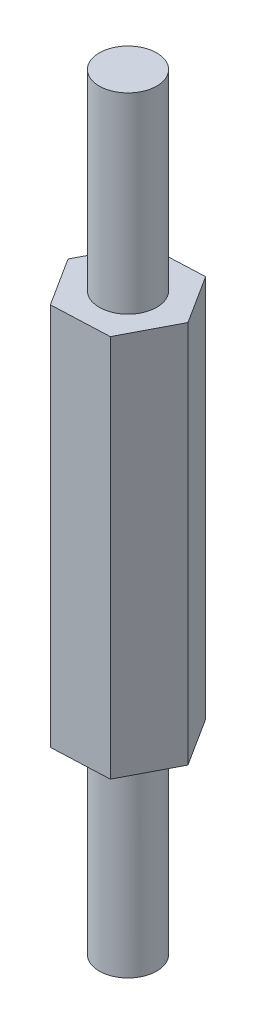
from build123d import *

# Parameters (mm, degrees)
BOSS_EXTRUDE1_DEPTH = 20
SKETCH4_R           = 1.5
BOSS_EXTRUDE2_DEPTH = 10
BOSS_EXTRUDE3_START = 10
SKETCH5_R           = 1.5
BOSS_EXTRUDE3_DEPTH = 10


with BuildPart() as part:
    # Sketch3 → Boss-Extrude1 (new body)
    with BuildSketch(Plane(origin=(0, 0, 0), x_dir=(1, 0, 0), z_dir=(0, 1, 0))):
        Polygon((1.388964752, 2.662182442), (-1.611035248, 2.533969981), (-3, -0.12821246), (-1.388964752, -2.662182442), (1.611035248, -2.533969981), (3, 0.12821246), align=None)
    extrude(amount=BOSS_EXTRUDE1_DEPTH)

    # Sketch4 → Boss-Extrude2 (add)
    with BuildSketch(Plane(origin=(0, 20, 0), x_dir=(1, 0, 0), z_dir=(0, 1, 0))):
        Circle(SKETCH4_R)
    extrude(amount=BOSS_EXTRUDE2_DEPTH)

    # Sketch5 → Boss-Extrude3 (add)
    with BuildSketch(Plane.XZ.offset(BOSS_EXTRUDE3_START)):
        Circle(SKETCH5_R)
    extrude(amount=-BOSS_EXTRUDE3_DEPTH)


solid = part.part
